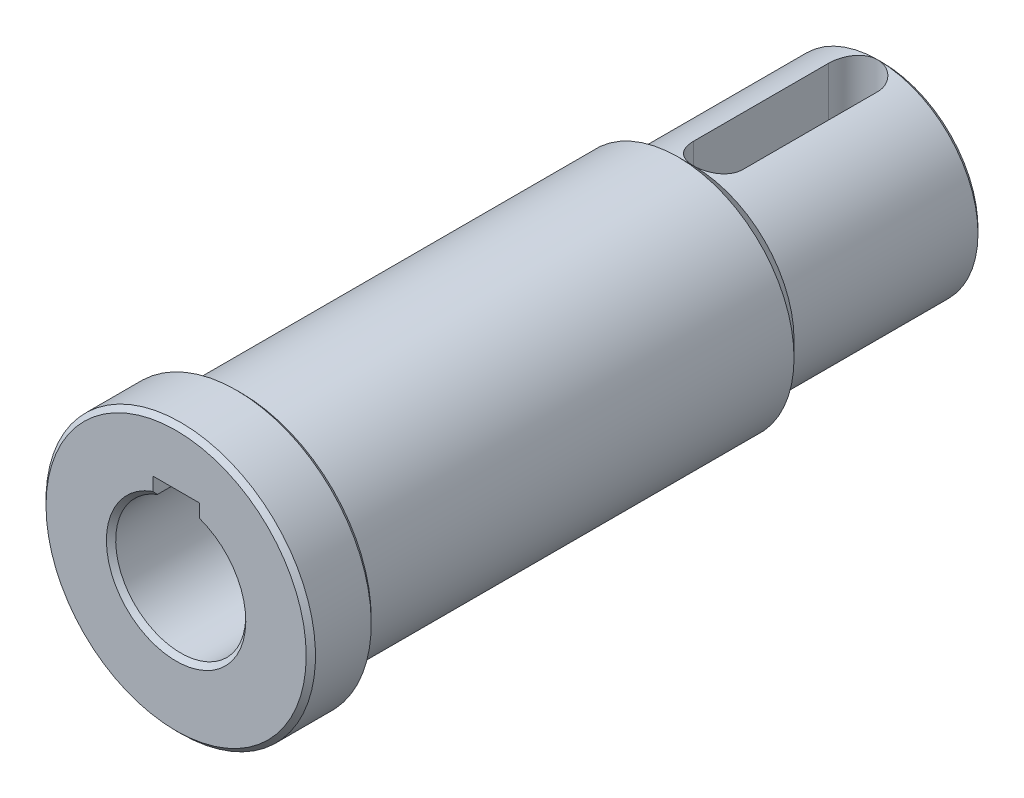
from build123d import *

# Parameters (mm, degrees)
FILLET_1_R          = 1
CHAMFER_1_SIZE      = 0.5
CHAMFER_2_SIZE      = 2
SKETCH_4_W          = 5
SKETCH_4_H          = 8.5
CUT_EXTRUDE_1_DEPTH = 30
CUT_EXTRUDE_2_DEPTH = 80.669630349


with BuildPart() as part:
    # 草图1 → 旋转1 (revolve)
    with BuildSketch(Plane(origin=(0, 0, 0), x_dir=(0, 0, -1), z_dir=(1, 0, 0))):
        Polygon((0, 0), (0, 14.5), (7, 14.5), (7, 12.5), (56, 12.5), (56, 10.795768266), (76, 10.795768266), (76, 0), align=None)
    revolve(axis=Axis((0, 0, -76), (0, 0, 1)))

    # 草图3 → 切除-旋转1 (revolve, cut)
    with BuildSketch(Plane(origin=(0, 0, 0), x_dir=(0, 0, -1), z_dir=(1, 0, 0))):
        Polygon((0, 0), (0, 7), (33.5, 7), (33.5, 2.75), (76, 2.75), (76, 0), align=None)
    revolve(axis=Axis((0, 0, -76), (0, 0, 1)), mode=Mode.SUBTRACT)

    # 圆角1
    fillet_1_edges = [part.edges().sort_by_distance(p)[0] for p in [
        (0, -7, -33.5),
    ]]
    fillet(fillet_1_edges, radius=FILLET_1_R)

    # 倒角1
    chamfer_1_edges = [part.edges().sort_by_distance(p)[0] for p in [
        (0, -7, 0),
        (0, -2.75, -33.5),
        (0, -2.75, -76),
        (0, -10.795768266, -76),
        (0, -14.5, -7),
        (0, -14.5, 0),
    ]]
    chamfer(chamfer_1_edges, length=CHAMFER_1_SIZE)

    # 倒角2
    # the kernel refuses this chamfer: 2 mm, written as the material it takes off along each edge
    with BuildSketch(Plane(origin=(0, 0, -56), x_dir=(0, 1, 0), z_dir=(1, 0, 0))) as chamfer_2_piece_1_section:
        Polygon((12.5, CHAMFER_2_SIZE), (12.5 - CHAMFER_2_SIZE, 0), (12.5, 0), align=None)
    chamfer_2_piece_1 = revolve(axis=Axis((0, 0, -56), (0, 0, 1)), mode=Mode.PRIVATE)
    chamfer_2_piece_1 = chamfer_2_piece_1 - Plane(origin=(0, 0, -54.862135047), x_dir=(0, 1, 0), z_dir=(0, 0, -1)) * Cylinder(10.795768266, 50, mode=Mode.PRIVATE)
    add(chamfer_2_piece_1, mode=Mode.SUBTRACT)

    # 草图4 → 切除-拉伸1 (cut)
    with BuildSketch(Plane.XY):
        with Locations((0, 4.25)):
            Rectangle(SKETCH_4_W, SKETCH_4_H)
    extrude(amount=-CUT_EXTRUDE_1_DEPTH, mode=Mode.SUBTRACT)

    # 草图5 → 切除-拉伸2 (cut, through all)
    with BuildSketch(Plane(origin=(0, 4.5, 0), x_dir=(1, 0, 0), z_dir=(0, 1, 0))):
        with BuildLine():
            Line((2.647884133, 72.852115867), (2.647884133, 58.352115867))
            ThreePointArc((2.647884133, 58.352115867), (0, 55.704231734), (-2.647884133, 58.352115867))
            Line((-2.647884133, 58.352115867), (-2.647884133, 72.852115867))
            ThreePointArc((-2.647884133, 72.852115867), (0, 75.5), (2.647884133, 72.852115867))
        make_face()
    extrude(amount=CUT_EXTRUDE_2_DEPTH, mode=Mode.SUBTRACT)


solid = part.part
